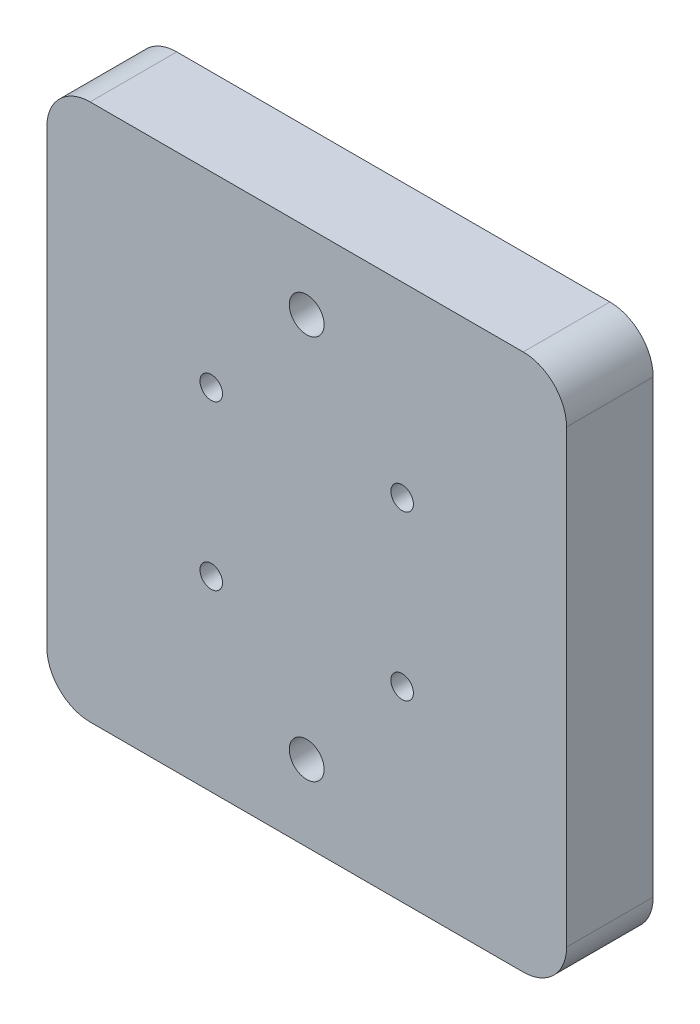
from build123d import *

# Parameters (mm, degrees)
SKETCH1_W               = 76.2
SKETCH1_H               = 78.74
BOSS_EXTRUDE1_DEPTH     = 12.7
F_1_4_20_TAPPED_HOLE1_D = 5.1054
M4_TAPPED_HOLE1_D       = 3.3
FILLET1_R               = 6.35


with BuildPart() as part:
    # Sketch1 → Boss-Extrude1 (new body)
    with BuildSketch(Plane.XY):
        Rectangle(SKETCH1_W, SKETCH1_H)
    extrude(amount=BOSS_EXTRUDE1_DEPTH)

    # 1/4-20 Tapped Hole1 (through all)
    with Locations(Plane(origin=(0, 0, 0), x_dir=(-1, 0, 0), z_dir=(0, 0, -1))):
        with Locations((0, 28.2321), (0, -28.2321)):
            Hole(F_1_4_20_TAPPED_HOLE1_D / 2)

    # M4 Tapped Hole1 (through all)
    with Locations(Plane(origin=(0, 0, 0), x_dir=(-1, 0, 0), z_dir=(0, 0, -1))):
        with Locations((-13.9954, 11.9888), (13.9954, 11.9888), (13.9954, -11.9888), (-13.9954, -11.9888)):
            Hole(M4_TAPPED_HOLE1_D / 2)

    # Fillet1
    fillet1_edges = [part.edges().sort_by_distance(p)[0] for p in [
        (-38.1, 39.37, 6.35),
        (-38.1, -39.37, 6.35),
        (38.1, -39.37, 6.35),
        (38.1, 39.37, 6.35),
    ]]
    fillet(fillet1_edges, radius=FILLET1_R)


solid = part.part
